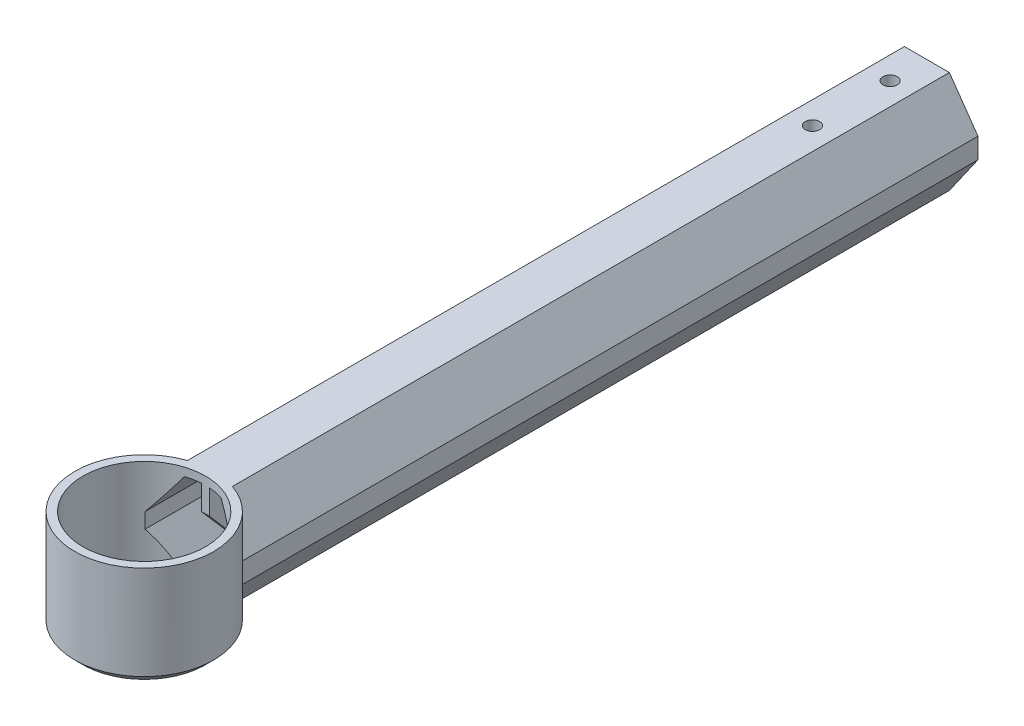
from build123d import *

# Parameters (mm, degrees)
ESTRUSIONE_ESTRUSIONE1_DEPTH = 180
SCHIZZO3_R                   = 17
TAGLIO_ESTRUSIONE2_DEPTH     = 183.295611683
SCHIZZO4_R                   = 15
ESTRUSIONE_ESTRUSIONE2_DEPTH = 25
ESTRUSIONE_ESTRUSIONE3_START = -2
SCHIZZO6_R                   = 15
ESTRUSIONE_ESTRUSIONE3_DEPTH = 2
TAGLIO_ESTRUSIONE4_REACH     = 211.92
TAGLIO_ESTRUSIONE5_REACH     = 211.843
ESTRUSIONE_ESTRUSIONE4_START = 1
SCHIZZO11_R                  = 15
ESTRUSIONE_ESTRUSIONE4_DEPTH = 1
SMUSSO1_SIZE                 = 2
SMUSSO1_SIZE_2               = 1.154700538
SMUSSO2_SIZE                 = 2
SCHIZZO12_R                  = 2.5
TAGLIO_ESTRUSIONE6_DEPTH     = 211.527047297
SCHIZZO13_R                  = 4.75
TAGLIO_ESTRUSIONE7_DEPTH     = 2
SCHIZZO14_R                  = 1.5
TAGLIO_ESTRUSIONE9_DEPTH     = 211.527047297
SCHIZZO15_R                  = 3.75
ESTRUSIONE_ESTRUSIONE5_DEPTH = 25
SCHIZZO16_R                  = 1.75
TAGLIO_ESTRUSIONE10_DEPTH    = 211.861655223
TAGLIO_ESTRUSIONE11_DEPTH    = 211.527047297


# Some blends are built 0.0001 mm under size
with BuildPart() as part:
    # Schizzo1 → Estrusione-Estrusione1 (new body)
    with BuildSketch(Plane.XY):
        Polygon((10.623281363, 5.122982669), (3.623281363, 15.122982669), (-7.376718637, 15.122982669), (-14.376718637, 5.122982669), (-14.376718637, 0.122982669), (-7.376718637, -9.877017331), (3.623281363, -9.877017331), (10.623281363, 0.122982669), align=None)
        Polygon((-12.376718637, 4.492538208), (-6.335407514, 13.122982669), (-2.876718637, 13.122982669), (-2.876718637, -7.877017331), (-6.335407514, -7.877017331), (-12.376718637, 0.753427131), align=None, mode=Mode.SUBTRACT)
        Polygon((2.58197024, -7.877017331), (-0.876718637, -7.877017331), (-0.876718637, 13.122982669), (2.58197024, 13.122982669), (8.623281363, 4.492538208), (8.623281363, 0.753427131), align=None, mode=Mode.SUBTRACT)
    extrude(amount=ESTRUSIONE_ESTRUSIONE1_DEPTH)

    # Schizzo3 → Taglio-Estrusione2 (cut, through all)
    with BuildSketch(Plane(origin=(0, 15.122982669, 0), x_dir=(1, 0, 0), z_dir=(0, 1, 0))):
        with Locations((-1.876718637, -191.521718622)):
            Circle(SCHIZZO3_R)
    extrude(amount=-TAGLIO_ESTRUSIONE2_DEPTH, mode=Mode.SUBTRACT)

    # Schizzo4 → Estrusione-Estrusione2 (add, through all)
    with BuildSketch(Plane(origin=(0, 15.122982669, 0), x_dir=(1, 0, 0), z_dir=(0, 1, 0))):
        with BuildLine():
            ThreePointArc((-7.376718637, -175.43601068), (-1.876718637, -208.521718622), (3.623281363, -175.43601068))
            ThreePointArc((3.623281363, -175.43601068), (-1.876718637, -174.521718622), (-7.376718637, -175.43601068))
        make_face()
        with Locations(Location((-1.876718637, -191.521718622, 0), (0, 0, 270))):
            Circle(SCHIZZO4_R, mode=Mode.SUBTRACT)
    extrude(amount=-ESTRUSIONE_ESTRUSIONE2_DEPTH)

    # Schizzo6 → Estrusione-Estrusione3 (add)
    with BuildSketch(Plane.XZ.offset(9.877017331).offset(ESTRUSIONE_ESTRUSIONE3_START)):
        with Locations(Location((-1.876718637, 191.521718622, 0), (0, 0, 90))):
            Circle(SCHIZZO6_R)
    extrude(amount=ESTRUSIONE_ESTRUSIONE3_DEPTH)

    # Schizzo8 → Taglio-Estrusione4 (cut, up to next)
    with BuildSketch(Plane(origin=(0, 0, 0), x_dir=(-1, 0, 0), z_dir=(0, 0, -1)), mode=Mode.PRIVATE) as taglio_estrusione4_sk1:
        Polygon((0.876718637, -7.877017331), (-2.58197024, -7.877017331), (-8.623281363, 0.753427131), (-8.623281363, 4.492538208), (-2.58197024, 13.122982669), (0.876718637, 13.122982669), align=None)
    taglio_estrusione4_tool1 = extrude(taglio_estrusione4_sk1.sketch, amount=-TAGLIO_ESTRUSIONE4_REACH, mode=Mode.PRIVATE) & part.part
    # Schizzo8 → Taglio-Estrusione4 (cut, up to next)
    with BuildSketch(Plane(origin=(0, 0, 0), x_dir=(-1, 0, 0), z_dir=(0, 0, -1)), mode=Mode.PRIVATE) as taglio_estrusione4_sk2:
        Polygon((2.876718637, -7.877017331), (2.876718637, 13.122982669), (6.335407514, 13.122982669), (12.376718637, 4.492538208), (12.376718637, 0.753427131), (6.335407514, -7.877017331), align=None)
    taglio_estrusione4_tool2 = extrude(taglio_estrusione4_sk2.sketch, amount=-TAGLIO_ESTRUSIONE4_REACH, mode=Mode.PRIVATE) & part.part
    add(taglio_estrusione4_tool1.solids().sort_by_distance((2.905149, 2.622983, 0))[0], mode=Mode.SUBTRACT)
    add(taglio_estrusione4_tool2.solids().sort_by_distance((-6.658586, 2.622983, 0))[0], mode=Mode.SUBTRACT)

    # Schizzo10 → Taglio-Estrusione5 (cut, up to next)
    with BuildSketch(Plane(origin=(-0.876718637, 0, 0), x_dir=(0, 0, -1), z_dir=(1, 0, 0)), mode=Mode.PRIVATE) as taglio_estrusione5_sk1:
        Polygon((-176.555089075, -7.877017331), (-176.555089075, 7.122982669), (-163.555089075, -7.877017331), align=None)
    taglio_estrusione5_tool1 = extrude(taglio_estrusione5_sk1.sketch, amount=-TAGLIO_ESTRUSIONE5_REACH, mode=Mode.PRIVATE) & part.part
    add(taglio_estrusione5_tool1.solids().sort_by_distance((-0.876719, -2.877017, 172.221756))[0], mode=Mode.SUBTRACT)

    # Schizzo11 → Estrusione-Estrusione4 (add)
    with BuildSketch(Plane(origin=(0, -7.877017331, 0), x_dir=(1, 0, 0), z_dir=(0, 1, 0)).offset(ESTRUSIONE_ESTRUSIONE4_START)):
        with Locations(Location((-1.876718637, -191.521718622, 0), (0, 0, 270))):
            Circle(SCHIZZO11_R)
    extrude(amount=-ESTRUSIONE_ESTRUSIONE4_DEPTH)

    # Smusso1
    # the kernel refuses this chamfer: 2, 1.154700538 mm, written as the material it adds along each edge
    with BuildSketch(Plane(origin=(-1.876718637, -7.877017331, 191.521718622), x_dir=(0.6026136012063945, 0, -0.7980331118700906), z_dir=(0.7980331118700906, 0, 0.6026136012063945))) as smusso1_piece_1_section:
        Polygon((15 + SMUSSO1_SIZE, 0), (15, SMUSSO1_SIZE_2), (15, 0), align=None)
    smusso1_piece_1 = revolve(axis=Axis((-1.876718637, -7.877017331, 191.521718622), (0, 1, 0)), revolution_arc=74.114626536, mode=Mode.PRIVATE)
    smusso1_piece_1 = split(smusso1_piece_1, bisect_by=Plane(origin=(5.278960516, -6.877017331, 177.600505235), z_dir=(0, -1, 0)), keep=Keep.TOP, mode=Mode.PRIVATE)
    add(smusso1_piece_1)

    # Smusso2
    smusso2_edges = [part.edges().sort_by_distance(p)[0] for p in [
        (-1.876718637, -9.877017331, 208.521718622),
    ]]
    chamfer(smusso2_edges, length=SMUSSO2_SIZE - 0.0001)  # a hair under: the kernel refuses the full size

    # Schizzo12 → Taglio-Estrusione6 (cut, through all)
    with BuildSketch(Plane(origin=(0, -6.877017331, 0), x_dir=(1, 0, 0), z_dir=(0, 1, 0))):
        with Locations(Location((-1.876718637, -191.521718622, 0), (0, 0, 270))):
            Circle(SCHIZZO12_R)
    extrude(amount=-TAGLIO_ESTRUSIONE6_DEPTH, mode=Mode.SUBTRACT)

    # Schizzo13 → Taglio-Estrusione7 (cut)
    with BuildSketch(Plane(origin=(0, -6.877017331, 0), x_dir=(1, 0, 0), z_dir=(0, 1, 0))):
        with Locations(Location((-1.876718637, -191.521718622, 0), (0, 0, 270))):
            Circle(SCHIZZO13_R)
    extrude(amount=-TAGLIO_ESTRUSIONE7_DEPTH, mode=Mode.SUBTRACT)

    # Schizzo14 → Taglio-Estrusione9 (cut, through all)
    with BuildSketch(Plane(origin=(0, -6.877017331, 0), x_dir=(1, 0, 0), z_dir=(0, 1, 0))):
        with Locations(Location((4.852993382, -198.227013257, 0), (0, 0, 270))):
            Circle(SCHIZZO14_R)
        with Locations(Location((-8.606430656, -184.816423987, 0), (0, 0, 270))):
            Circle(SCHIZZO14_R)
        with Locations(Location((-7.52328254, -197.188844533, 0), (0, 0, 270))):
            Circle(SCHIZZO14_R)
        with Locations(Location((3.769845266, -185.854592711, 0), (0, 0, 270))):
            Circle(SCHIZZO14_R)
    extrude(amount=-TAGLIO_ESTRUSIONE9_DEPTH, mode=Mode.SUBTRACT)

    # Schizzo15 → Estrusione-Estrusione5 (add)
    with BuildSketch(Plane(origin=(0, 15.122982669, 0), x_dir=(1, 0, 0), z_dir=(0, 1, 0))):
        with Locations((-1.876718637, -28)):
            Circle(SCHIZZO15_R)
        with Locations((-1.876718637, -9)):
            Circle(SCHIZZO15_R)
    extrude(amount=-ESTRUSIONE_ESTRUSIONE5_DEPTH)

    # Schizzo16 → Taglio-Estrusione10 (cut, through all)
    with BuildSketch(Plane(origin=(0, 15.122982669, 0), x_dir=(1, 0, 0), z_dir=(0, 1, 0))):
        with Locations(Location((-1.876718637, -28, 0), (0, 0, 270))):
            Circle(SCHIZZO16_R)
        with Locations(Location((-1.876718637, -9, 0), (0, 0, 270))):
            Circle(SCHIZZO16_R)
    extrude(amount=-TAGLIO_ESTRUSIONE10_DEPTH, mode=Mode.SUBTRACT)

    # Schizzo17 → Taglio-Estrusione11 (cut, through all)
    with BuildSketch(Plane(origin=(0, -6.877017331, 0), x_dir=(1, 0, 0), z_dir=(0, 1, 0))):
        with BuildLine():
            Line((-8.78535733, -190.040708293), (-13.650216694, -189.259165677))
            ThreePointArc((-13.650216694, -189.259165677), (-15.876718637, -191.521718622), (-13.650216694, -193.784271566))
            Line((-13.650216694, -193.784271566), (-8.78535733, -193.002728951))
            ThreePointArc((-8.78535733, -193.002728951), (-7.52328254, -191.521718622), (-8.78535733, -190.040708293))
        make_face()
        with BuildLine():
            Line((-0.395708308, -184.613079929), (0.385834308, -179.748220565))
            ThreePointArc((0.385834308, -179.748220565), (-1.876718637, -177.521718622), (-4.139271581, -179.748220565))
            Line((-4.139271581, -179.748220565), (-3.357728966, -184.613079929))
            ThreePointArc((-3.357728966, -184.613079929), (-1.876718637, -185.875154719), (-0.395708308, -184.613079929))
        make_face()
        with BuildLine():
            Line((5.031920056, -193.002728951), (9.89677942, -193.784271566))
            ThreePointArc((9.89677942, -193.784271566), (12.123281363, -191.521718622), (9.89677942, -189.259165677))
            Line((9.89677942, -189.259165677), (5.031920056, -190.040708293))
            ThreePointArc((5.031920056, -190.040708293), (3.769845266, -191.521718622), (5.031920056, -193.002728951))
        make_face()
        with BuildLine():
            Line((-3.357728966, -198.430357315), (-4.139271581, -203.295216678))
            ThreePointArc((-4.139271581, -203.295216678), (-1.876718637, -205.521718622), (0.385834308, -203.295216678))
            Line((0.385834308, -203.295216678), (-0.395708308, -198.430357315))
            ThreePointArc((-0.395708308, -198.430357315), (-1.876718637, -197.168282525), (-3.357728966, -198.430357315))
        make_face()
    extrude(amount=-TAGLIO_ESTRUSIONE11_DEPTH, mode=Mode.SUBTRACT)


solid = part.part
